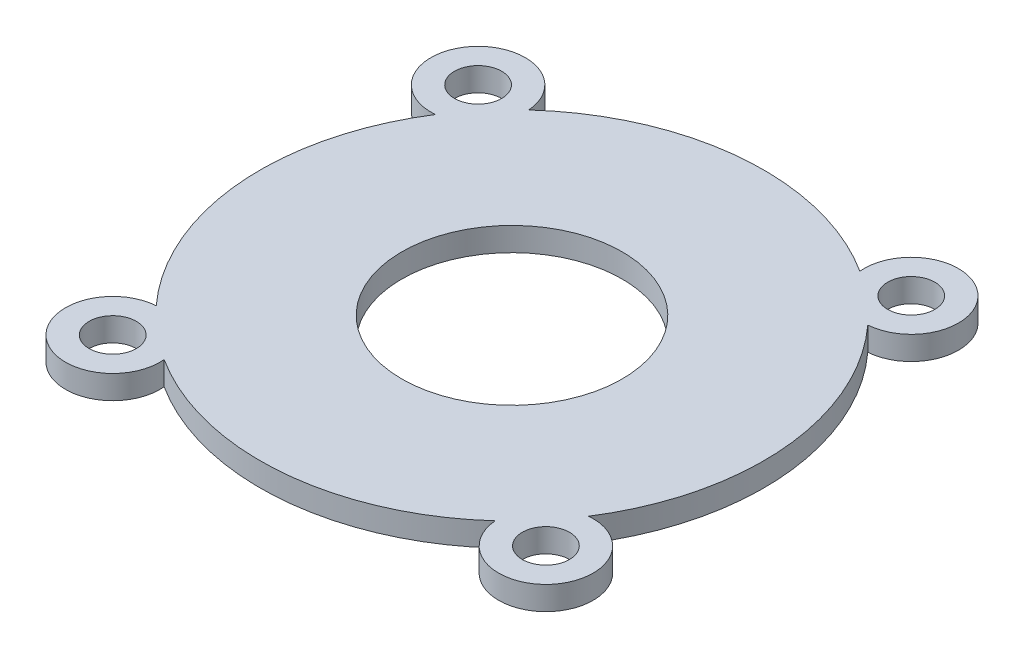
from build123d import *

# Parameters (mm, degrees)
SKETCH1_R           = 7
SKETCH1_R_2         = 1.5
BOSS_EXTRUDE1_DEPTH = 1.5
SKETCH1_3_R         = 13
SKETCH1_3_R_2       = 11
BOSS_EXTRUDE2_DEPTH = 1


with BuildPart() as part:
    # Sketch1 → Boss-Extrude1 (new body)
    with BuildSketch(Plane(origin=(0, 0, 0), x_dir=(1, 0, 0), z_dir=(0, 1, 0))):
        with BuildLine():
            ThreePointArc((13.480501214, -8.618357559), (15.942627678, 1.353743966), (11.834344184, 10.76792913))
            ThreePointArc((11.834344184, 10.76792913), (13.539616916, 16.052375954), (8.618357559, 13.480501214))
            ThreePointArc((8.618357559, 13.480501214), (-1.353743966, 15.942627678), (-10.76792913, 11.834344184))
            ThreePointArc((-10.76792913, 11.834344184), (-16.052375954, 13.539616916), (-13.480501214, 8.618357559))
            ThreePointArc((-13.480501214, 8.618357559), (-15.942627678, -1.353743966), (-11.834344184, -10.76792913))
            ThreePointArc((-11.834344184, -10.76792913), (-13.539616916, -16.052375954), (-8.618357559, -13.480501214))
            ThreePointArc((-8.618357559, -13.480501214), (1.353743966, -15.942627678), (10.76792913, -11.834344184))
            ThreePointArc((10.76792913, -11.834344184), (16.052375954, -13.539616916), (13.480501214, -8.618357559))
        make_face()
        Circle(SKETCH1_R, mode=Mode.SUBTRACT)
        with Locations((13.759179389, -11.605385928)):
            Circle(SKETCH1_R_2, mode=Mode.SUBTRACT)
        with Locations((-11.605385928, -13.759179389)):
            Circle(SKETCH1_R_2, mode=Mode.SUBTRACT)
        with Locations((-13.759179389, 11.605385928)):
            Circle(SKETCH1_R_2, mode=Mode.SUBTRACT)
        with Locations((11.605385928, 13.759179389)):
            Circle(SKETCH1_R_2, mode=Mode.SUBTRACT)
    extrude(amount=BOSS_EXTRUDE1_DEPTH)

    # Sketch1<3> → Boss-Extrude2 (add)
    with BuildSketch(Plane(origin=(0, 0, 0), x_dir=(1, 0, 0), z_dir=(0, 1, 0))):
        Circle(SKETCH1_3_R)
        Circle(SKETCH1_3_R_2, mode=Mode.SUBTRACT)
    extrude(amount=-BOSS_EXTRUDE2_DEPTH)


solid = part.part
